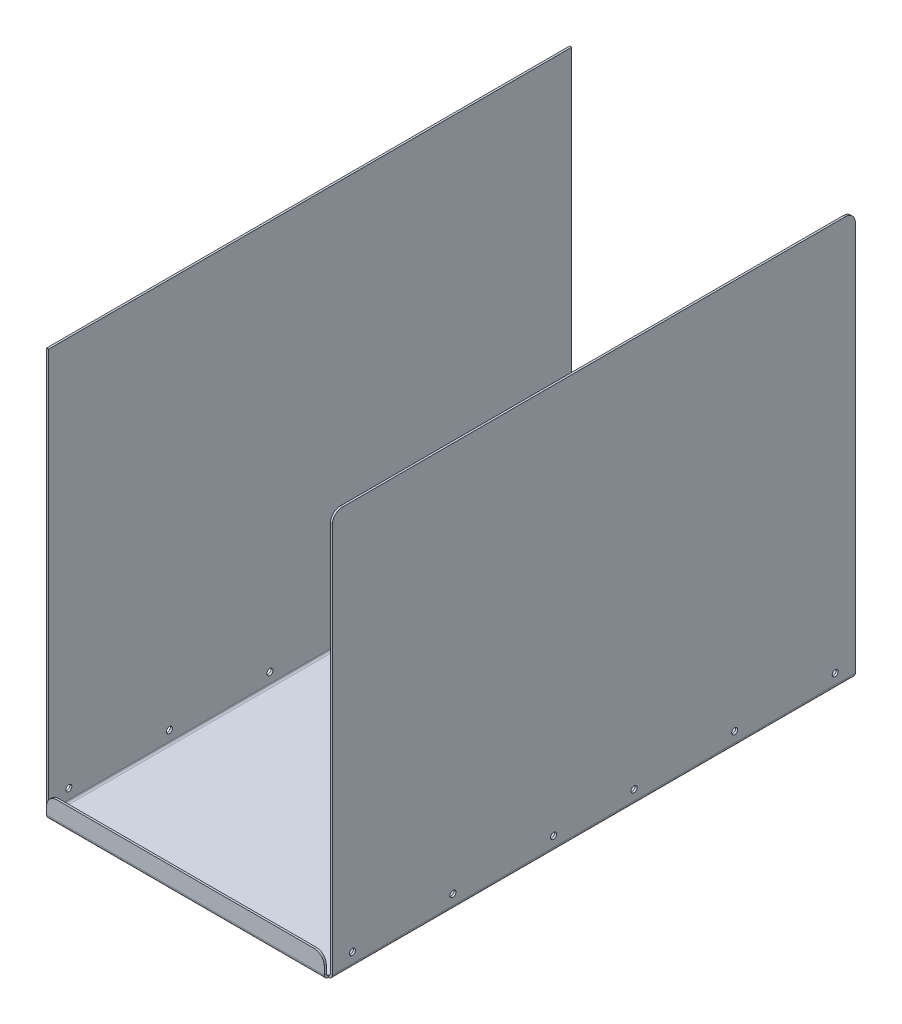
from build123d import *

# Parameters (mm, degrees)
SKETCH1_W                    = 142
SKETCH1_H                    = 260
BASE_FLANGE1_DEPTH           = 1
EDGE_FLANGE1_STRIP_W         = 6
EDGE_FLANGE1_STRIP_H         = 1
EDGE_FLANGE1_STRIP_CUT_DEPTH = 260
EDGE_FLANGE1_DEPTH           = 260
EDGE_FLANGE2_STRIP_W         = 6
EDGE_FLANGE2_STRIP_H         = 1
EDGE_FLANGE2_STRIP_CUT_DEPTH = 260
EDGE_FLANGE2_DEPTH           = 260
EDGE_FLANGE2_FLAT_DEPTH      = 1
EDGE_FLANGE4_DEPTH           = 138
EDGE_FLANGE4_START           = 1
EDGE_FLANGE4_FLAT_DEPTH      = 1
SKETCH12_R                   = 1.5
CUT_EXTRUDE1_DEPTH           = 157
EDGE_FLANGE5_DEPTH           = 138
EDGE_FLANGE5_START           = 1
EDGE_FLANGE5_FLAT_DEPTH      = 1


# Sheet-metal steps are written as plain solids
with BuildPart() as part:
    # Sketch1 → Base-Flange1 (new body)
    with BuildSketch(Plane(origin=(0, 0, 0), x_dir=(1, 0, 0), z_dir=(0, 1, 0))):
        with Locations((71, 130)):
            Rectangle(SKETCH1_W, SKETCH1_H)
    extrude(amount=-BASE_FLANGE1_DEPTH)

    # Edge-Flange1 strip (across the edge) → Edge-Flange1 strip cut (cut)
    with BuildSketch(Plane.XY.offset(-260)):
        with Locations((-1, -0.5)):
            Rectangle(EDGE_FLANGE1_STRIP_W, EDGE_FLANGE1_STRIP_H)
    extrude(amount=EDGE_FLANGE1_STRIP_CUT_DEPTH, mode=Mode.SUBTRACT)

    # Edge-Flange1 section (across the edge) → Edge-Flange1 (add)
    with BuildSketch(Plane.XY.offset(-260)):
        with BuildLine():
            Line((0, 1), (0, 200))
            Line((0, 200), (1, 200))
            Line((1, 200), (1, 1))
            ThreePointArc((1, 1), (1.292893219, 0.292893219), (2, 0))
            Line((2, 0), (2, -1))
            ThreePointArc((2, -1), (0.585786438, -0.414213562), (0, 1))
        make_face()
    extrude(amount=EDGE_FLANGE1_DEPTH)

    # Edge-Flange2 strip (across the edge) → Edge-Flange2 strip cut (cut)
    with BuildSketch(Plane(origin=(142, 0, 0), x_dir=(-1, 0, 0), z_dir=(0, 0, -1))):
        with Locations((-1, -0.5)):
            Rectangle(EDGE_FLANGE2_STRIP_W, EDGE_FLANGE2_STRIP_H)
    extrude(amount=EDGE_FLANGE2_STRIP_CUT_DEPTH, mode=Mode.SUBTRACT)

    # Edge-Flange2 bend section (across the edge) → Edge-Flange2 (add)
    with BuildSketch(Plane(origin=(142, 0, 0), x_dir=(-1, 0, 0), z_dir=(0, 0, -1))):
        with BuildLine():
            Line((0, 1), (1, 1))
            ThreePointArc((1, 1), (1.292893219, 0.292893219), (2, 0))
            Line((2, 0), (2, -1))
            ThreePointArc((2, -1), (0.585786438, -0.414213562), (0, 1))
        make_face()
    extrude(amount=EDGE_FLANGE2_DEPTH)

    # Edge-Flange2 profile (on flange) → Edge-Flange2 flat (add)
    with BuildSketch(Plane(origin=(142, 0, 0), x_dir=(0, 0, -1), z_dir=(1, 0, 0))):
        with BuildLine():
            ThreePointArc((5, 200), (1.464466094, 198.535533906), (0, 195))
            Line((0, 195), (0, 1))
            Line((0, 1), (260, 1))
            Line((260, 1), (260, 195))
            ThreePointArc((260, 195), (258.535533906, 198.535533906), (255, 200))
            Line((255, 200), (5, 200))
        make_face()
    extrude(amount=-EDGE_FLANGE2_FLAT_DEPTH)

    # Edge-Flange4 bend section (across the edge) → Edge-Flange4 (add)
    with BuildSketch(Plane(origin=(140, 0, -261), x_dir=(0, 0, 1), z_dir=(-1, 0, 0))):
        with BuildLine():
            Line((-1, 1), (0, 1))
            ThreePointArc((0, 1), (0.292893219, 0.292893219), (1, 0))
            Line((1, 0), (1, -1))
            ThreePointArc((1, -1), (-0.414213562, -0.414213562), (-1, 1))
        make_face()
    extrude(amount=EDGE_FLANGE4_DEPTH)

    # Edge-Flange4 profile (on flange) → Edge-Flange4 flat (add)
    with BuildSketch(Plane(origin=(0, 0, -261), x_dir=(-1, 0, 0), z_dir=(0, 0, -1)).offset(EDGE_FLANGE4_START)):
        with BuildLine():
            Line((-7, 10), (-135, 10))
            ThreePointArc((-135, 10), (-138.535533906, 8.535533906), (-140, 5))
            Line((-140, 5), (-140, 1))
            Line((-140, 1), (-2, 1))
            Line((-2, 1), (-2, 5))
            ThreePointArc((-2, 5), (-3.464466094, 8.535533906), (-7, 10))
        make_face()
    extrude(amount=-EDGE_FLANGE4_FLAT_DEPTH)

    # Sketch12 → Cut-Extrude1 (cut)
    with BuildSketch(Plane.ZY):
        with Locations(Location((-110, 6, 0), (0, 0, 270))):
            Circle(SKETCH12_R)
        with Locations(Location((-60, 6, 0), (0, 0, 270))):
            Circle(SKETCH12_R)
        with Locations(Location((-10, 6, 0), (0, 0, 270))):
            Circle(SKETCH12_R)
        with Locations(Location((-150, 6, 0), (0, 0, 270))):
            Circle(SKETCH12_R)
        with Locations(Location((-200, 6, 0), (0, 0, 270))):
            Circle(SKETCH12_R)
        with Locations(Location((-250, 6, 0), (0, 0, 270))):
            Circle(SKETCH12_R)
    extrude(amount=-CUT_EXTRUDE1_DEPTH, mode=Mode.SUBTRACT)

    # Edge-Flange5 bend section (across the edge) → Edge-Flange5 (add)
    with BuildSketch(Plane(origin=(2, 0, 1), x_dir=(0, 0, -1), z_dir=(1, 0, 0))):
        with BuildLine():
            Line((-1, 1), (0, 1))
            ThreePointArc((0, 1), (0.292893219, 0.292893219), (1, 0))
            Line((1, 0), (1, -1))
            ThreePointArc((1, -1), (-0.414213562, -0.414213562), (-1, 1))
        make_face()
    extrude(amount=EDGE_FLANGE5_DEPTH)

    # Edge-Flange5 profile (on flange) → Edge-Flange5 flat (add)
    with BuildSketch(Plane.XY.offset(1).offset(EDGE_FLANGE5_START)):
        with BuildLine():
            Line((135, 10), (7, 10))
            ThreePointArc((7, 10), (3.464466094, 8.535533906), (2, 5))
            Line((2, 5), (2, 1))
            Line((2, 1), (140, 1))
            Line((140, 1), (140, 5))
            ThreePointArc((140, 5), (138.535533906, 8.535533906), (135, 10))
        make_face()
    extrude(amount=-EDGE_FLANGE5_FLAT_DEPTH)


solid = part.part
